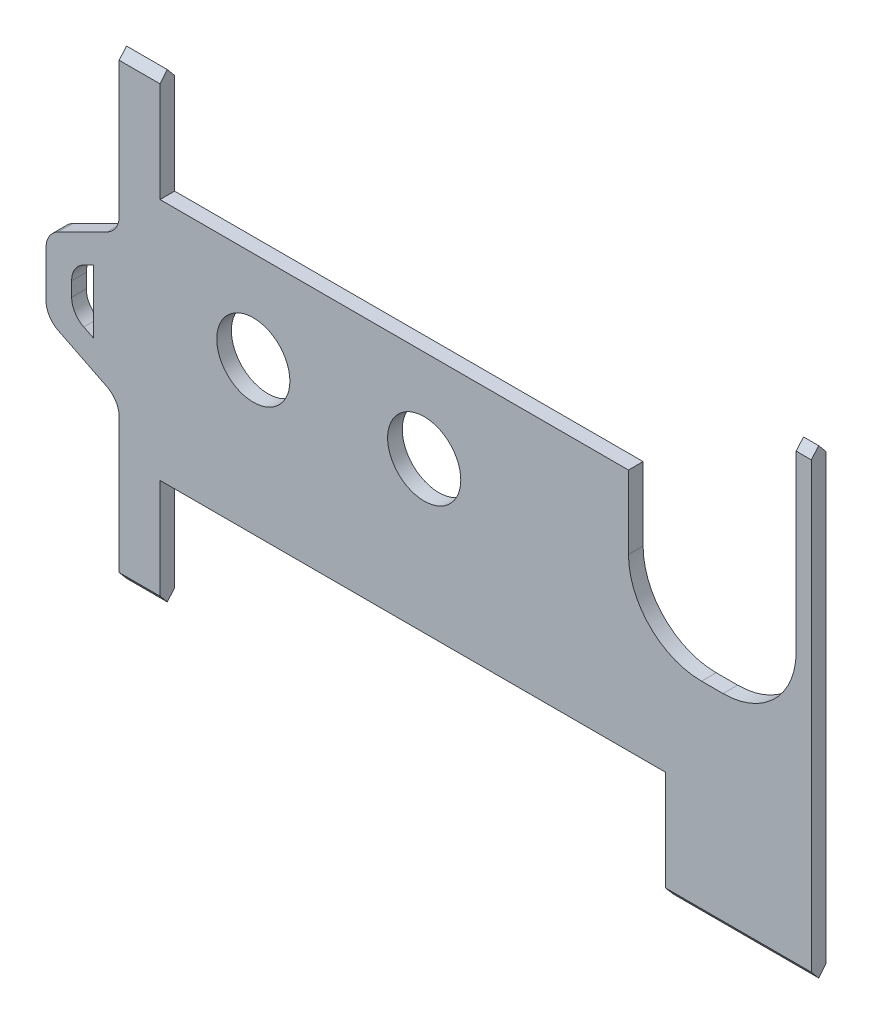
from build123d import *

# Parameters (mm, degrees)
SKETCH1_R           = 5
BOSS_EXTRUDE1_DEPTH = 1
CUT_EXTRUDE1_DEPTH  = 161.061343452
FILLET1_R           = 10
FILLET2_R           = 3


with BuildPart() as part:
    # Sketch1 → Boss-Extrude1 (new, symmetric)
    with BuildSketch(Plane.XY.offset(11.1483132)):
        Polygon((12.423, 91.8975), (22.423, 86.8975), (22.423, 65.272), (28.004353293, 65.272), (28.004353293, 80.272), (97.123000954, 80.272), (97.123000954, 65.272), (117.048, 65.272), (117.048, 128.523), (114.975774521, 128.523), (114.975774521, 93.523), (92.048, 93.523), (92.048, 113.523), (28.004353293, 113.523), (28.004353293, 128.523), (22.423, 128.523), (22.423, 106.8975), (12.423, 101.8975), align=None)
        Polygon((18.923, 92.560618961), (15.923, 94.060618961), (15.923, 99.734381039), (18.923, 101.234381039), align=None, mode=Mode.SUBTRACT)
        with Locations((64.122810805, 100.881519454)):
            Circle(SKETCH1_R, mode=Mode.SUBTRACT)
        with Locations((40.75880907, 100.906977446)):
            Circle(SKETCH1_R, mode=Mode.SUBTRACT)
    extrude(amount=BOSS_EXTRUDE1_DEPTH, both=True)

    # Sketch2 → Cut-Extrude1 (cut, through all)
    with BuildSketch(Plane.ZY.offset(-22.423)):
        Polygon((10.101339955, 128.523), (10.101339955, 127.168225732), (11.1483132, 128.412378938), (12.195286445, 127.168225732), (12.195286445, 128.523), align=None)
        Polygon((12.195286445, 66.626774268), (12.195286445, 65.272), (10.101339955, 65.272), (10.101339955, 66.626774268), (11.1483132, 65.382621062), align=None)
    extrude(amount=-CUT_EXTRUDE1_DEPTH, mode=Mode.SUBTRACT)

    # Fillet1
    fillet1_edges = [part.edges().sort_by_distance(p)[0] for p in [
        (92.048, 93.523, 11.1483132),
        (114.975774521, 93.523, 11.1483132),
    ]]
    fillet(fillet1_edges, radius=FILLET1_R)

    # Fillet2
    fillet2_edges = [part.edges().sort_by_distance(p)[0] for p in [
        (15.923, 99.734381039, 11.1483132),
        (15.923, 94.060618961, 11.1483132),
        (22.423, 106.8975, 11.1483132),
        (12.423, 101.8975, 11.1483132),
        (12.423, 91.8975, 11.1483132),
        (22.423, 86.8975, 11.1483132),
    ]]
    fillet(fillet2_edges, radius=FILLET2_R)


solid = part.part
